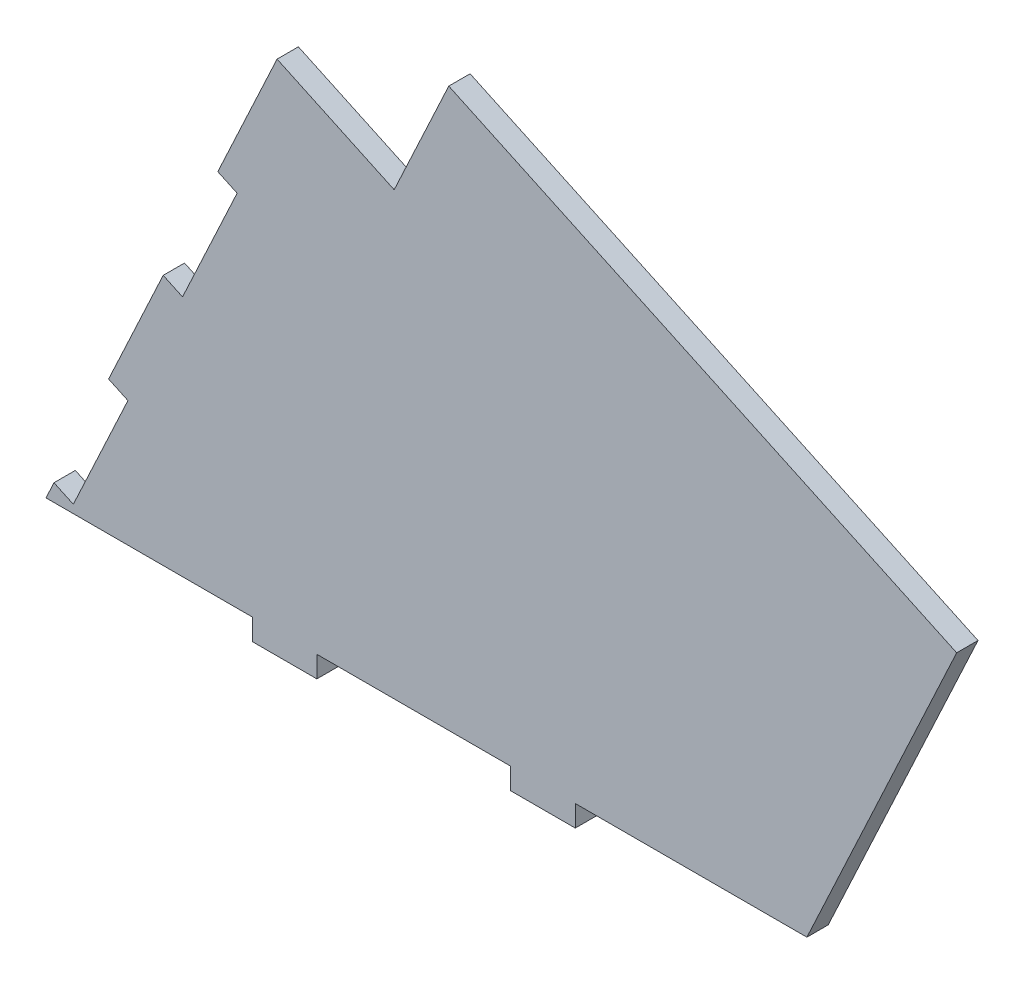
from build123d import *

# Parameters (mm, degrees)
BOSS_EXTRUDE1_DEPTH = 3.3
CUT_EXTRUDE1_DEPTH  = 3.3
SKETCH3_W           = 10
SKETCH3_H           = 3.3
BOSS_EXTRUDE2_DEPTH = 3.3


with BuildPart() as part:
    # Sketch1 → Boss-Extrude1 (new body)
    with BuildSketch(Plane.XY.offset(396.7)):
        Polygon((-321.546211223, 12.634626083), (-203.763939035, 12.634626089), (-180.579435925, 62.353953457), (-259.198908878, 99.014815774), (-267.651274112, 80.888660034), (-285.777429853, 89.341025269), align=None)
    extrude(amount=-BOSS_EXTRUDE1_DEPTH)

    # Sketch2 → Cut-Extrude1 (cut)
    with BuildSketch(Plane.XY.offset(396.7)):
        Polygon((-311.856397536, 33.414498593), (-320.308762771, 15.288342852), (-317.317947074, 13.893702588), (-308.865581839, 32.019858329), align=None)
        Polygon((-303.404032301, 51.540654333), (-294.951667066, 69.666810074), (-291.960851369, 68.27216981), (-300.413216604, 50.14601407), align=None)
    extrude(amount=-CUT_EXTRUDE1_DEPTH, mode=Mode.SUBTRACT)

    # Sketch3 → Boss-Extrude2 (add)
    with BuildSketch(Plane.XY.offset(396.7)):
        with Locations((-244.617848709, 10.984626083)):
            Rectangle(SKETCH3_W, SKETCH3_H)
        with Locations((-284.617848709, 10.984626083)):
            Rectangle(SKETCH3_W, SKETCH3_H)
    extrude(amount=-BOSS_EXTRUDE2_DEPTH)


solid = part.part
